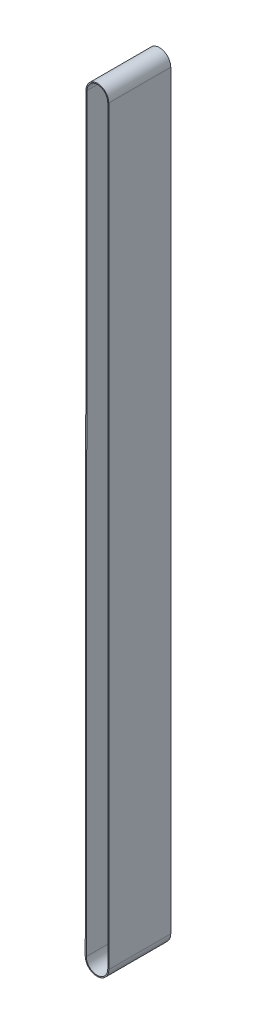
from build123d import *

# Parameters (mm, degrees)
EXTRUDE_THIN3_DEPTH = 300


with BuildPart() as part:
    # Sketch1 → Extrude-Thin3 (new, symmetric)
    with BuildSketch(Plane.XY):
        with BuildLine():
            Line((114, -3670), (114, 3595))
            ThreePointArc((114, 3595), (4.002818531, 3704.999999964), (-105.999999856, 3595.005637062))
            Line((-105.999999856, 3595.005637062), (-113.999930882, -3669.874465707))
            ThreePointArc((-113.999930882, -3669.874465707), (-0.062767156, -3783.999982721), (114, -3670))
        make_face()
        with BuildLine():
            Line((104, -3670), (104, 3595))
            ThreePointArc((104, 3595), (4, 3695), (-96, 3595))
            Line((-96, 3595), (-103.999936945, -3669.885477488))
            ThreePointArc((-103.999936945, -3669.885477488), (-0.057261265, -3773.999984236), (104, -3670))
        make_face(mode=Mode.SUBTRACT)
    extrude(amount=EXTRUDE_THIN3_DEPTH, both=True)


solid = part.part
